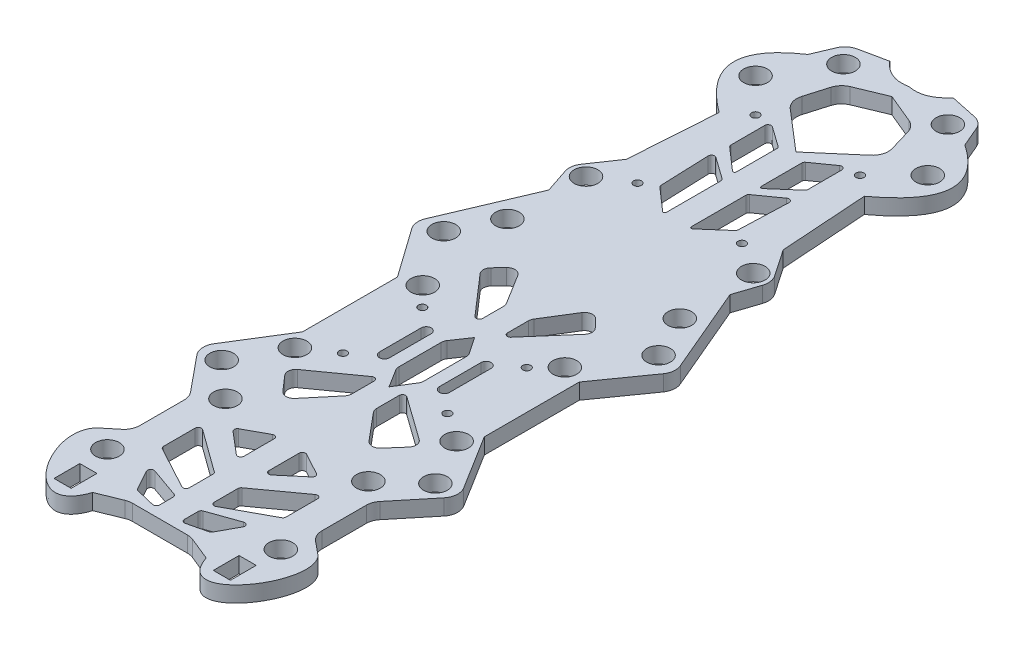
from build123d import *

# Parameters (mm, degrees)
BOSS_EXTRUDE1_DEPTH = 10
SKETCH2_R           = 7.5
SKETCH2_R_2         = 2.5
SKETCH2_W           = 10.826162164
SKETCH2_H           = 16.307274757
CUT_EXTRUDE1_DEPTH  = 10
SCALE1_SCALE        = 0.5


with BuildPart() as part:
    # Sketch1 → Boss-Extrude1 (new body)
    with BuildSketch(Plane(origin=(0, 0, 0), x_dir=(1, 0, 0), z_dir=(0, 1, 0))):
        with BuildLine():
            Line((-20, 108.666913672), (-37.02155544, 105.099442524))
            ThreePointArc((-37.02155544, 105.099442524), (-41.318352018, 103.038788908), (-44.173577983, 99.22349877))
            Line((-44.173577983, 99.22349877), (-49.563132922, 86.542193031))
            add(Edge.make_bspline(
                [(-49.563132922, 86.542193031), (-90.261698828, 59.180995604), (-45.847296839, 26.749883242)],
                knots=[0, 0, 0, 1, 1, 1], degree=2))
            Line((-45.847296839, 26.749883242), (-49.563132922, -28.250116758))
            Line((-49.563132922, -28.250116758), (-61.171078315, -45.271946335))
            ThreePointArc((-61.171078315, -45.271946335), (-62.813156949, -49.522755188), (-62.398618811, -54.060811632))
            Line((-62.398618811, -54.060811632), (-57.252124127, -69.54103979))
            Line((-57.252124127, -69.54103979), (-80.493793257, -124.227320097))
            ThreePointArc((-80.493793257, -124.227320097), (-81.233212634, -129.207440106), (-79.452315735, -133.916658996))
            Line((-79.452315735, -133.916658996), (-57.448306065, -164.999234461))
            Line((-57.448306065, -164.999234461), (-57.448306065, -224.999234461))
            Line((-57.448306065, -224.999234461), (-78.887835285, -259.441224098))
            ThreePointArc((-78.887835285, -259.441224098), (-80.377026298, -265.377156079), (-78.128872064, -271.069148778))
            Line((-78.128872064, -271.069148778), (-59.826749184, -293.373990041))
            ThreePointArc((-59.826749184, -293.373990041), (-58.141785967, -296.348782437), (-57.557361425, -299.71730419))
            Line((-57.557361425, -299.71730419), (-57.557361425, -327.686018252))
            ThreePointArc((-57.557361425, -327.686018252), (-58.517639596, -331.961930934), (-61.214047277, -335.416630493))
            Line((-61.214047277, -335.416630493), (-70.116813587, -342.72174964))
            add(Edge.make_bspline(
                [(-70.116813587, -342.72174964), (-85.380761454, -360.617872003), (-47.702704033, -414.790448784), (-35.84330039, -379.184902554)],
                knots=[0, 0, 0, 0, 1, 1, 1, 1], degree=3))
            Line((-35.84330039, -379.184902554), (-21.276300392, -373.244087391))
            ThreePointArc((-21.276300392, -373.244087391), (-19.42410289, -372.690507328), (-17.5, -372.503653004))
            Line((-17.5, -372.503653004), (17.5, -372.503653004))
            ThreePointArc((17.5, -372.503653004), (19.42410289, -372.690507328), (21.276300392, -373.244087391))
            Line((21.276300392, -373.244087391), (35.84330039, -379.184902554))
            add(Edge.make_bspline(
                [(70.116813587, -342.72174964), (85.380761454, -360.617872003), (47.702704033, -414.790448784), (35.84330039, -379.184902554)],
                knots=[0, 0, 0, 0, 1, 1, 1, 1], degree=3))
            Line((70.116813587, -342.72174964), (61.214047277, -335.416630493))
            ThreePointArc((61.214047277, -335.416630493), (58.517639596, -331.961930934), (57.557361425, -327.686018252))
            Line((57.557361425, -327.686018252), (57.557361425, -299.71730419))
            ThreePointArc((57.557361425, -299.71730419), (58.141785967, -296.348782437), (59.826749184, -293.373990041))
            Line((59.826749184, -293.373990041), (78.128872064, -271.069148778))
            ThreePointArc((78.128872064, -271.069148778), (80.377026298, -265.377156079), (78.887835285, -259.441224098))
            Line((78.887835285, -259.441224098), (57.448306065, -224.999234461))
            Line((57.448306065, -224.999234461), (57.448306065, -164.999234461))
            Line((57.448306065, -164.999234461), (79.452315735, -133.916658996))
            ThreePointArc((79.452315735, -133.916658996), (81.233212634, -129.207440106), (80.493793257, -124.227320097))
            Line((80.493793257, -124.227320097), (57.252124127, -69.54103979))
            Line((57.252124127, -69.54103979), (62.398618811, -54.060811632))
            ThreePointArc((62.398618811, -54.060811632), (62.813156949, -49.522755188), (61.171078315, -45.271946335))
            Line((61.171078315, -45.271946335), (49.563132922, -28.250116758))
            Line((49.563132922, -28.250116758), (45.847296839, 26.749883242))
            add(Edge.make_bspline(
                [(49.563132922, 86.542193031), (90.261698828, 59.180995604), (45.847296839, 26.749883242)],
                knots=[0, 0, 0, 1, 1, 1], degree=2))
            Line((49.563132922, 86.542193031), (44.173577983, 99.22349877))
            ThreePointArc((44.173577983, 99.22349877), (41.318352018, 103.038788908), (37.02155544, 105.099442524))
            Line((37.02155544, 105.099442524), (20, 108.666913672))
            add(Edge.make_bspline(
                [(0, 100.857290109), (11.443577156, 98.505807219), (20, 108.666913672)],
                knots=[0, 0, 0, 1, 1, 1], degree=2))
            add(Edge.make_bspline(
                [(0, 100.857290109), (-11.443577156, 98.505807219), (-20, 108.666913672)],
                knots=[0, 0, 0, 1, 1, 1], degree=2))
        make_face()
    extrude(amount=BOSS_EXTRUDE1_DEPTH)

    # Sketch2 → Cut-Extrude1 (cut)
    with BuildSketch(Plane(origin=(0, 10, 0), x_dir=(1, 0, 0), z_dir=(0, 1, 0))):
        with Locations((-33.002430118, 92.392162319)):
            Circle(SKETCH2_R)
        with Locations((-54.429498505, 58.267571925)):
            Circle(SKETCH2_R)
        with Locations((-33.002430118, 36.840503538)):
            Circle(SKETCH2_R_2)
        with Locations((-33.002430118, -37.757438254)):
            Circle(SKETCH2_R_2)
        with Locations((-52.842308254, -50.454960261)):
            Circle(SKETCH2_R)
        with Locations((-44.906356999, -161.558277823)):
            Circle(SKETCH2_R)
        with Locations((-51.104533071, -236.156219614)):
            Circle(SKETCH2_R)
        with Locations((-67.532821313, -265.971312525)):
            Circle(SKETCH2_R)
        with Locations((-45.172141538, -285.971312525)):
            Circle(SKETCH2_R)
        with Locations((-33.002430118, -173.738568918)):
            Circle(SKETCH2_R_2)
        with Locations((-33.002430118, -223.892002662)):
            Circle(SKETCH2_R_2)
        with Locations((33.002430118, -223.892002662)):
            Circle(SKETCH2_R_2)
        with Locations((33.002430118, -173.738568918)):
            Circle(SKETCH2_R_2)
        with Locations((45.172141538, -285.971312525)):
            Circle(SKETCH2_R)
        with Locations((67.532821313, -265.971312525)):
            Circle(SKETCH2_R)
        with Locations((51.104533071, -236.156219614)):
            Circle(SKETCH2_R)
        with Locations((44.906356999, -161.558277823)):
            Circle(SKETCH2_R)
        with Locations((52.842308254, -50.454960261)):
            Circle(SKETCH2_R)
        with Locations((33.002430118, -37.757438254)):
            Circle(SKETCH2_R_2)
        with Locations((33.002430118, 36.840503538)):
            Circle(SKETCH2_R_2)
        with Locations((54.429498505, 58.267571925)):
            Circle(SKETCH2_R)
        with Locations((33.002430118, 92.392162319)):
            Circle(SKETCH2_R)
        with Locations((-54.773397255, -350.928818249)):
            Circle(SKETCH2_R)
        with Locations((54.773397255, -350.928818249)):
            Circle(SKETCH2_R)
        with Locations((-67.887227727, -125.328132997)):
            Circle(SKETCH2_R)
        with Locations((-54.468589143, -98.496432742)):
            Circle(SKETCH2_R)
        with Locations((54.468589143, -98.496432742)):
            Circle(SKETCH2_R)
        with Locations((67.887227727, -125.328132997)):
            Circle(SKETCH2_R)
        with BuildLine():
            Line((0, 90.014717885), (-18.613845546, 82.258596759))
            ThreePointArc((-18.613845546, 82.258596759), (-22.210865585, 79.705984124), (-24.359833015, 75.854189295))
            Line((-24.359833015, 75.854189295), (-28.54526137, 61.649099122))
            ThreePointArc((-28.54526137, 61.649099122), (-28.543193633, 55.989491263), (-25.469265906, 51.237425006))
            Line((-25.469265906, 51.237425006), (0, 29.357787493))
            Line((0, 29.357787493), (25.469265906, 51.237425006))
            ThreePointArc((25.469265906, 51.237425006), (28.543193633, 55.989491263), (28.54526137, 61.649099122))
            Line((28.54526137, 61.649099122), (24.359833015, 75.854189295))
            ThreePointArc((24.359833015, 75.854189295), (22.210865585, 79.705984124), (18.613845546, 82.258596759))
            Line((18.613845546, 82.258596759), (0, 90.014717885))
        make_face()
        with BuildLine():
            Line((-8.71566269, 26.803219505), (-21.200773397, 35.681659386))
            ThreePointArc((-21.200773397, 35.681659386), (-23.276861031, 35.829131663), (-24.359833015, 34.051757303))
            Line((-24.359833015, 34.051757303), (-24.359833015, 12.684369173))
            ThreePointArc((-24.359833015, 12.684369173), (-24.181152046, 11.858053865), (-23.677036027, 11.179385377))
            Line((-23.677036027, 11.179385377), (-9.533323815, -1.199578682))
            ThreePointArc((-9.533323815, -1.199578682), (-8.461564655, -1.357746299), (-7.874722309, -0.447086784))
            Line((-7.874722309, -0.447086784), (-7.874722309, 25.173317422))
            ThreePointArc((-7.874722309, 25.173317422), (-8.097347948, 26.090345437), (-8.71566269, 26.803219505))
        make_face()
        with BuildLine():
            Line((-8.71566269, -8.57201079), (-22.392733965, 1.154058759))
            ThreePointArc((-22.392733965, 1.154058759), (-24.501913955, 1.284063287), (-25.55039348, -0.550666145))
            Line((-25.55039348, -0.550666145), (-24.392105343, -31.489816967))
            ThreePointArc((-24.392105343, -31.489816967), (-24.199046179, -32.275239846), (-23.710708459, -32.919977941))
            Line((-23.710708459, -32.919977941), (-9.533323815, -45.328413034))
            ThreePointArc((-9.533323815, -45.328413034), (-8.461564655, -45.486580651), (-7.874722309, -44.575921136))
            Line((-7.874722309, -44.575921136), (-7.874722309, -10.201912873))
            ThreePointArc((-7.874722309, -10.201912873), (-8.097347948, -9.284884858), (-8.71566269, -8.57201079))
        make_face()
        with BuildLine():
            Line((-28.146749755, -125.328132997), (-32.955834422, -130.386535512))
            ThreePointArc((-32.955834422, -130.386535512), (-34.330890873, -133.720505021), (-33.10536336, -137.11229146))
            Line((-33.10536336, -137.11229146), (-11.384017212, -162.095063473))
            ThreePointArc((-11.384017212, -162.095063473), (-9.174218849, -162.656113701), (-7.874722309, -160.782802487))
            Line((-7.874722309, -160.782802487), (-7.874722309, -147.555832839))
            ThreePointArc((-7.874722309, -147.555832839), (-8.066084665, -146.185794879), (-8.625523913, -144.920626396))
            Line((-8.625523913, -144.920626396), (-20.273843039, -126.138030037))
            ThreePointArc((-20.273843039, -126.138030037), (-24.011384555, -123.799484653), (-28.146749755, -125.328132997))
        make_face()
        with BuildLine():
            Line((0, -173.738568918), (-7.014377278, -184.093615068))
            ThreePointArc((-7.014377278, -184.093615068), (-7.654799445, -185.431183044), (-7.874722309, -186.89776498))
            Line((-7.874722309, -186.89776498), (-7.874722309, -213.676579873))
            ThreePointArc((-7.874722309, -213.676579873), (-7.683359953, -215.046617833), (-7.123920704, -216.311786316))
            Line((-7.123920704, -216.311786316), (0, -227.798913826))
            Line((0, -227.798913826), (7.123920704, -216.311786316))
            ThreePointArc((7.123920704, -216.311786316), (7.683359953, -215.046617833), (7.874722309, -213.676579873))
            Line((7.874722309, -213.676579873), (7.874722309, -186.89776498))
            ThreePointArc((7.874722309, -186.89776498), (7.654799445, -185.431183044), (7.014377278, -184.093615068))
            Line((7.014377278, -184.093615068), (0, -173.738568918))
        make_face()
        with BuildLine():
            Line((-15.758382178, -185.363708212), (-15.758382178, -211.669897198))
            ThreePointArc((-15.758382178, -211.669897198), (-18.952971256, -214.864486276), (-22.147560334, -211.669897198))
            Line((-22.147560334, -211.669897198), (-22.147560334, -185.363708212))
            ThreePointArc((-22.147560334, -185.363708212), (-18.952971256, -182.169119134), (-15.758382178, -185.363708212))
        make_face()
        with BuildLine():
            Line((-7.874722309, -229.173656023), (-7.874722309, -243.469301305))
            ThreePointArc((-7.874722309, -243.469301305), (-8.175191959, -245.176466935), (-9.040488104, -246.678451982))
            Line((-9.040488104, -246.678451982), (-23.377020969, -263.807477767))
            ThreePointArc((-23.377020969, -263.807477767), (-27.158202105, -265.59804562), (-30.97652774, -263.888117737))
            Line((-30.97652774, -263.888117737), (-39.229280786, -254.442573028))
            ThreePointArc((-39.229280786, -254.442573028), (-40.4303784, -250.573846088), (-38.371613479, -247.085125604))
            Line((-38.371613479, -247.085125604), (-11.037764412, -227.546593312))
            ThreePointArc((-11.037764412, -227.546593312), (-8.959868279, -227.395161687), (-7.874722309, -229.173656023))
        make_face()
        with BuildLine():
            Line((-10.833701175, -290.67178286), (-24.571828885, -298.178255062))
            ThreePointArc((-24.571828885, -298.178255062), (-25.602594294, -299.731069078), (-24.905411704, -301.459549664))
            Line((-24.905411704, -301.459549664), (-11.167283994, -313.094581577))
            ThreePointArc((-11.167283994, -313.094581577), (-9.033628786, -313.38292401), (-7.874722309, -311.568382282))
            Line((-7.874722309, -311.568382282), (-7.874722309, -292.426878166))
            ThreePointArc((-7.874722309, -292.426878166), (-8.854417877, -290.7067099), (-10.833701175, -290.67178286))
        make_face()
        with BuildLine():
            Line((-35.534160074, -310.03088685), (-8.700701455, -329.487311455))
            ThreePointArc((-8.700701455, -329.487311455), (-8.093144117, -330.197636249), (-7.874722309, -331.106470198))
            Line((-7.874722309, -331.106470198), (-7.874722309, -346.097554833))
            ThreePointArc((-7.874722309, -346.097554833), (-8.850932684, -347.815651106), (-10.826577112, -347.856523972))
            Line((-10.826577112, -347.856523972), (-37.660035732, -333.335770928))
            ThreePointArc((-37.660035732, -333.335770928), (-38.426277201, -332.600591414), (-38.708180928, -331.576801789))
            Line((-38.708180928, -331.576801789), (-38.708180928, -311.650045593))
            ThreePointArc((-38.708180928, -311.650045593), (-37.617014877, -309.868467401), (-35.534160074, -310.03088685))
        make_face()
        with BuildLine():
            Line((-10.339352947, -366.846455291), (-22.427094936, -363.959296508))
            ThreePointArc((-22.427094936, -363.959296508), (-23.176957533, -363.60304226), (-23.717559604, -362.972994322))
            Line((-23.717559604, -362.972994322), (-30.495831443, -350.567597796))
            ThreePointArc((-30.495831443, -350.567597796), (-30.263541214, -348.31206014), (-28.073910102, -347.7230572))
            Line((-28.073910102, -347.7230572), (-9.207896274, -354.394994258))
            ThreePointArc((-9.207896274, -354.394994258), (-8.241680352, -355.125924461), (-7.874722309, -356.280555989))
            Line((-7.874722309, -356.280555989), (-7.874722309, -364.90117424))
            ThreePointArc((-7.874722309, -364.90117424), (-8.635622086, -366.471088453), (-10.339352947, -366.846455291))
        make_face()
        with Locations((-50.319438081, -375.588770026)):
            Rectangle(SKETCH2_W, SKETCH2_H)
        with BuildLine():
            Line((15.758382178, -185.363708212), (15.758382178, -211.669897198))
            ThreePointArc((15.758382178, -211.669897198), (18.952971256, -214.864486276), (22.147560334, -211.669897198))
            Line((22.147560334, -211.669897198), (22.147560334, -185.363708212))
            ThreePointArc((22.147560334, -185.363708212), (18.952971256, -182.169119134), (15.758382178, -185.363708212))
        make_face()
        with Locations((50.319438081, -375.588770026)):
            Rectangle(SKETCH2_W, SKETCH2_H)
        with BuildLine():
            Line((7.874722309, -356.280555989), (7.874722309, -364.90117424))
            ThreePointArc((7.874722309, -364.90117424), (8.635622086, -366.471088453), (10.339352947, -366.846455291))
            Line((10.339352947, -366.846455291), (22.427094936, -363.959296508))
            ThreePointArc((22.427094936, -363.959296508), (23.176957533, -363.60304226), (23.717559604, -362.972994322))
            Line((23.717559604, -362.972994322), (30.495831443, -350.567597796))
            ThreePointArc((30.495831443, -350.567597796), (30.263541214, -348.31206014), (28.073910102, -347.7230572))
            Line((28.073910102, -347.7230572), (9.207896274, -354.394994258))
            ThreePointArc((9.207896274, -354.394994258), (8.241680352, -355.125924461), (7.874722309, -356.280555989))
        make_face()
        with BuildLine():
            Line((38.708180928, -331.576801789), (38.708180928, -311.650045593))
            ThreePointArc((38.708180928, -311.650045593), (37.617014877, -309.868467401), (35.534160074, -310.03088685))
            Line((35.534160074, -310.03088685), (8.700701455, -329.487311455))
            ThreePointArc((8.700701455, -329.487311455), (8.093144117, -330.197636249), (7.874722309, -331.106470198))
            Line((7.874722309, -331.106470198), (7.874722309, -346.097554833))
            ThreePointArc((7.874722309, -346.097554833), (8.850932684, -347.815651106), (10.826577112, -347.856523972))
            Line((10.826577112, -347.856523972), (37.660035732, -333.335770928))
            ThreePointArc((37.660035732, -333.335770928), (38.426277201, -332.600591414), (38.708180928, -331.576801789))
        make_face()
        with BuildLine():
            Line((7.874722309, -311.568382282), (7.874722309, -292.426878166))
            ThreePointArc((7.874722309, -292.426878166), (8.854417877, -290.7067099), (10.833701175, -290.67178286))
            Line((10.833701175, -290.67178286), (24.571828885, -298.178255062))
            ThreePointArc((24.571828885, -298.178255062), (25.602594294, -299.731069078), (24.905411704, -301.459549664))
            Line((24.905411704, -301.459549664), (11.167283994, -313.094581577))
            ThreePointArc((11.167283994, -313.094581577), (9.033628786, -313.38292401), (7.874722309, -311.568382282))
        make_face()
        with BuildLine():
            Line((38.371613479, -247.085125604), (11.037764412, -227.546593312))
            ThreePointArc((11.037764412, -227.546593312), (8.959868279, -227.395161687), (7.874722309, -229.173656023))
            Line((7.874722309, -229.173656023), (7.874722309, -243.469301305))
            ThreePointArc((7.874722309, -243.469301305), (8.175191959, -245.176466935), (9.040488104, -246.678451982))
            Line((9.040488104, -246.678451982), (23.377020969, -263.807477767))
            ThreePointArc((23.377020969, -263.807477767), (27.158202105, -265.59804562), (30.97652774, -263.888117737))
            Line((30.97652774, -263.888117737), (39.229280786, -254.442573028))
            ThreePointArc((39.229280786, -254.442573028), (40.4303784, -250.573846088), (38.371613479, -247.085125604))
        make_face()
        with BuildLine():
            Line((8.625523913, -144.920626396), (20.273843039, -126.138030037))
            ThreePointArc((20.273843039, -126.138030037), (24.011384555, -123.799484653), (28.146749755, -125.328132997))
            Line((28.146749755, -125.328132997), (32.955834422, -130.386535512))
            ThreePointArc((32.955834422, -130.386535512), (34.330890873, -133.720505021), (33.10536336, -137.11229146))
            Line((33.10536336, -137.11229146), (11.384017212, -162.095063473))
            ThreePointArc((11.384017212, -162.095063473), (9.174218849, -162.656113701), (7.874722309, -160.782802487))
            Line((7.874722309, -160.782802487), (7.874722309, -147.555832839))
            ThreePointArc((7.874722309, -147.555832839), (8.066084665, -146.185794879), (8.625523913, -144.920626396))
        make_face()
        with BuildLine():
            Line((7.874722309, -44.575921136), (7.874722309, -10.201912873))
            ThreePointArc((7.874722309, -10.201912873), (8.097347948, -9.284884858), (8.71566269, -8.57201079))
            Line((8.71566269, -8.57201079), (22.392733965, 1.154058759))
            ThreePointArc((22.392733965, 1.154058759), (24.501913955, 1.284063287), (25.55039348, -0.550666145))
            Line((25.55039348, -0.550666145), (24.392105343, -31.489816967))
            ThreePointArc((24.392105343, -31.489816967), (24.199046179, -32.275239846), (23.710708459, -32.919977941))
            Line((23.710708459, -32.919977941), (9.533323815, -45.328413034))
            ThreePointArc((9.533323815, -45.328413034), (8.461564655, -45.486580651), (7.874722309, -44.575921136))
        make_face()
        with BuildLine():
            Line((7.874722309, -0.447086784), (7.874722309, 25.173317422))
            ThreePointArc((7.874722309, 25.173317422), (8.097347948, 26.090345437), (8.71566269, 26.803219505))
            Line((8.71566269, 26.803219505), (21.200773397, 35.681659386))
            ThreePointArc((21.200773397, 35.681659386), (23.276861031, 35.829131663), (24.359833015, 34.051757303))
            Line((24.359833015, 34.051757303), (24.359833015, 12.684369173))
            ThreePointArc((24.359833015, 12.684369173), (24.181152046, 11.858053865), (23.677036027, 11.179385377))
            Line((23.677036027, 11.179385377), (9.533323815, -1.199578682))
            ThreePointArc((9.533323815, -1.199578682), (8.461564655, -1.357746299), (7.874722309, -0.447086784))
        make_face()
    extrude(amount=-CUT_EXTRUDE1_DEPTH, mode=Mode.SUBTRACT)


with BuildPart() as part_1:
    # Scale1: scaled about (0, 5, 149.746703967)
    add(part.part.scale(SCALE1_SCALE).moved(Location((0, 2.5, 74.873351984))))


solid = part_1.part
